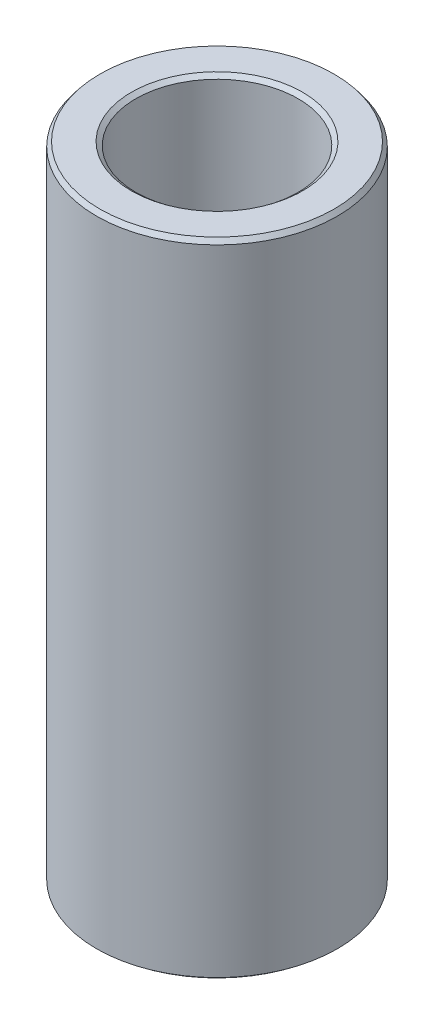
from build123d import *
from OCP.BRepFilletAPI import BRepFilletAPI_MakeChamfer

# Parameters (mm, degrees)
SKETCH1_R           = 7.5
BOSS_EXTRUDE1_DEPTH = 39.993163642
SKETCH2_R           = 5.055140066
CUT_EXTRUDE1_DEPTH  = 42.375755439
CHAMFER1_SIZE       = 0.272003693
CHAMFER1_SIZE2      = 0.213018417


with BuildPart() as part:
    # Sketch1 → Boss-Extrude1 (new body)
    with BuildSketch(Plane(origin=(0, 0, 0), x_dir=(1, 0, 0), z_dir=(0, 1, 0))):
        Circle(SKETCH1_R)
    extrude(amount=BOSS_EXTRUDE1_DEPTH)

    # Sketch2 → Cut-Extrude1 (cut, through all)
    with BuildSketch(Plane(origin=(0, 0, 0), x_dir=(1, 0, 0), z_dir=(0, 1, 0))):
        Circle(SKETCH2_R)
    extrude(amount=CUT_EXTRUDE1_DEPTH, mode=Mode.SUBTRACT)

    # Chamfer1: one chamfer whose edges measure the first distance from different faces: ONE call of the kernel's chamfer builder (chamfer() names one face for all edges)
    chamfer1_edges_1 = [part.edges().sort_by_distance(p)[0] for p in [
        (-5.055140066, 39.993163642, 0),
    ]]
    chamfer1_side_1 = [part.faces().sort_by_distance(p)[0] for p in [
        (-7.287867966, 39.993163642, 0),
    ]]
    chamfer1_edges_2 = [part.edges().sort_by_distance(p)[0] for p in [
        (-5.055140066, 0, 0),
    ]]
    chamfer1_side_2 = [part.faces().sort_by_distance(p)[0] for p in [
        (-5.055140066, 19.996581821, 0),
    ]]
    chamfer1_edges_3 = [part.edges().sort_by_distance(p)[0] for p in [
        (-7.5, 0, 0),
    ]]
    chamfer1_side_3 = [part.faces().sort_by_distance(p)[0] for p in [
        (-7.287867966, 0, 0),
    ]]
    chamfer1_edges_4 = [part.edges().sort_by_distance(p)[0] for p in [
        (-7.5, 39.993163642, 0),
    ]]
    chamfer1_side_4 = [part.faces().sort_by_distance(p)[0] for p in [
        (-7.5, 19.996581821, 0),
    ]]
    chamfer1 = BRepFilletAPI_MakeChamfer(part.part.solid().wrapped)
    for e in chamfer1_edges_1:
        chamfer1.Add(CHAMFER1_SIZE, CHAMFER1_SIZE2, e.wrapped, chamfer1_side_1[0].wrapped)  # the first distance lies on this face
    for e in chamfer1_edges_2:
        chamfer1.Add(CHAMFER1_SIZE, CHAMFER1_SIZE2, e.wrapped, chamfer1_side_2[0].wrapped)  # the first distance lies on this face
    for e in chamfer1_edges_3:
        chamfer1.Add(CHAMFER1_SIZE, CHAMFER1_SIZE2, e.wrapped, chamfer1_side_3[0].wrapped)  # the first distance lies on this face
    for e in chamfer1_edges_4:
        chamfer1.Add(CHAMFER1_SIZE, CHAMFER1_SIZE2, e.wrapped, chamfer1_side_4[0].wrapped)  # the first distance lies on this face
    add(Compound.cast(chamfer1.Shape()), mode=Mode.REPLACE)


solid = part.part
